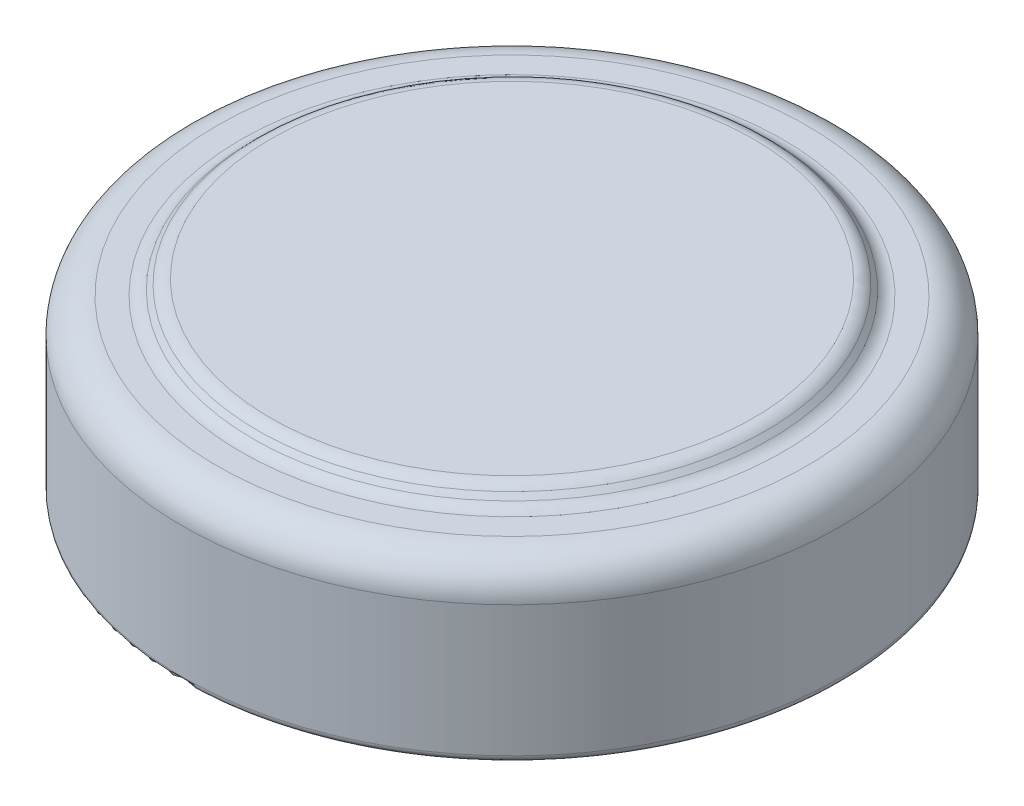
from build123d import *


with BuildPart() as part:
    # Sketch1 → Revolve1 (revolve)
    with BuildSketch(Plane.XY):
        with BuildLine():
            Line((0, 0), (-4.65, 0))
            ThreePointArc((-4.65, 0), (-4.720710678, 0.029289322), (-4.75, 0.1))
            Line((-4.75, 0.1), (-4.75, 1.985))
            ThreePointArc((-4.75, 1.985), (-4.603553391, 2.338553391), (-4.25, 2.485))
            Line((-4.25, 2.485), (-3.903553391, 2.485))
            ThreePointArc((-3.903553391, 2.485), (-3.807882533, 2.504030117), (-3.726776695, 2.558223305))
            Line((-3.726776695, 2.558223305), (-3.658223305, 2.626776695))
            ThreePointArc((-3.658223305, 2.626776695), (-3.577117467, 2.680969883), (-3.481446609, 2.7))
            Line((-3.481446609, 2.7), (0, 2.7))
            Line((0, 2.7), (0, 0))
        make_face()
    revolve(axis=Axis((0, 2.7, 0), (0, -1, 0)))


solid = part.part
